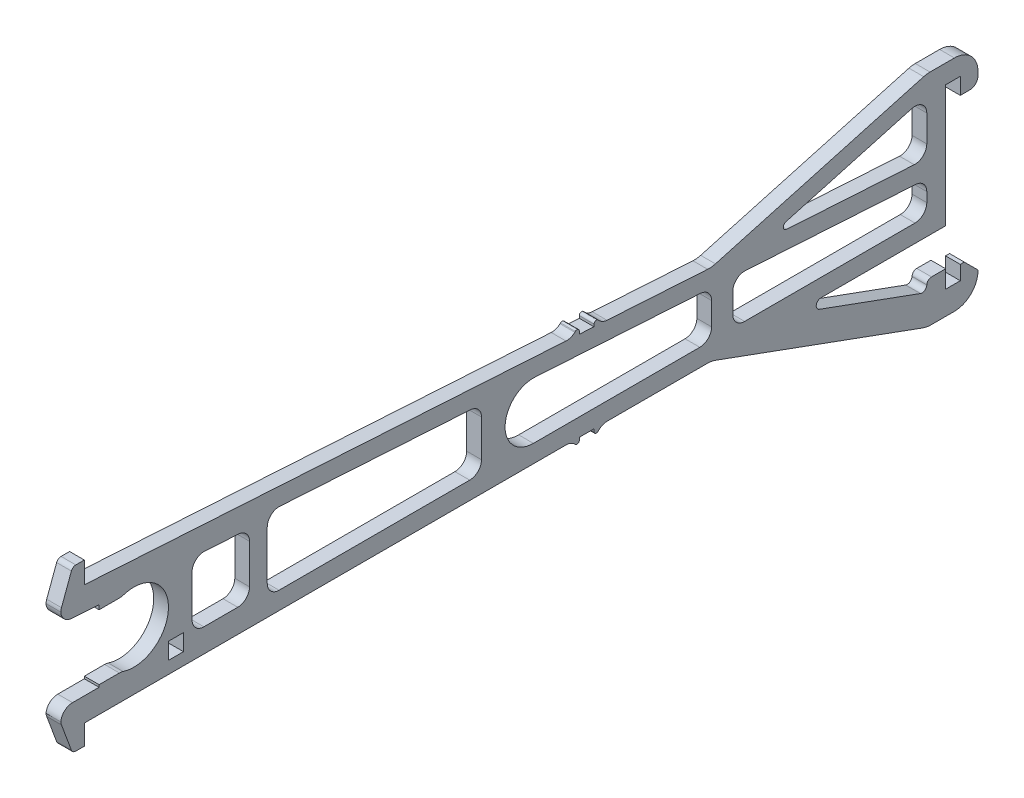
from build123d import *

# Parameters (mm, degrees)
BOSS_EXTRUDE1_DEPTH = 1.5875
CUT_EXTRUDE2_DEPTH  = 93.054574745
FILLET1_R           = 2.54
FILLET2_R           = 1.27
FILLET3_R           = 0.508
FILLET4_R           = 0.508
BOSS_EXTRUDE3_DEPTH = 1.5875
FILLET5_R           = 1.27
FILLET6_R           = 0.254
BOSS_EXTRUDE4_DEPTH = 1.5875
CUT_EXTRUDE1_REACH  = 94.055
FILLET9_R           = 1.27
FILLET10_R          = 0.381
FILLET12_R          = 1.27
FILLET13_R          = 0.508


with BuildPart() as part:
    # Sketch1 → Boss-Extrude1 (new body)
    with BuildSketch(Plane(origin=(0, 0, 0), x_dir=(0, 0, -1), z_dir=(1, 0, 0))):
        with BuildLine():
            Line((62.185099246, -6.2738), (85.344, -14.722370106))
            Line((85.344, -14.722370106), (88.3158, -14.722370106))
            ThreePointArc((88.3158, -14.722370106), (90.111851224, -13.978421331), (90.8558, -12.182370106))
            Line((90.8558, -12.182370106), (90.8558, -12.131570106))
            Line((90.8558, -12.131570106), (89.3826, -10.658370106))
            Line((89.3826, -10.658370106), (88.9508, -10.658370106))
            Line((88.9508, -10.658370106), (88.9508, -12.182370106))
            Line((88.9508, -12.182370106), (87.376, -12.182370106))
            Line((87.376, -12.182370106), (87.376, -10.277370106))
            Line((87.376, -10.277370106), (85.344, -10.277370106))
            Line((85.344, -10.277370106), (85.344, -11.477881212))
            Line((85.344, -11.477881212), (71.07876946, -6.2738))
            Line((71.07876946, -6.2738), (87.376, -6.2738))
            Line((87.376, -6.2738), (87.376, 6.867629894))
            Line((87.376, 6.867629894), (88.9508, 6.867629894))
            Line((88.9508, 6.867629894), (88.9508, 5.089629894))
            Line((88.9508, 5.089629894), (89.9668, 5.089629894))
            ThreePointArc((89.9668, 5.089629894), (90.595417928, 5.350011965), (90.8558, 5.978629894))
            Line((90.8558, 5.978629894), (90.8558, 6.359629894))
            ThreePointArc((90.8558, 6.359629894), (90.111851224, 8.155681118), (88.3158, 8.899629894))
            Line((88.3158, 8.899629894), (85.344, 8.899629894))
            Line((85.344, 8.899629894), (62.185099246, 2.453000952))
            Line((62.185099246, 2.453000952), (-5.3213, 6.613676867))
            Line((-5.3213, 6.613676867), (-5.3213, 8.924406911))
            Line((-5.3213, 8.924406911), (-7.8613, 8.924406911))
            Line((-7.8613, 8.924406911), (-7.8613, 4.225406911))
            Line((-7.8613, 4.225406911), (-3.7338, 3.971013401))
            Line((-3.7338, 3.971013401), (-3.7338, 3.488413401))
            Line((-3.7338, 3.488413401), (-1.331252938, 3.488413401))
            ThreePointArc((-1.331252938, 3.488413401), (3.7338, 0), (-1.331252938, -3.488413401))
            Line((-1.331252938, -3.488413401), (-3.7338, -3.488413401))
            Line((-3.7338, -3.488413401), (-3.7338, -3.7338))
            Line((-3.7338, -3.7338), (-5.3213, -3.7338))
            Line((-5.3213, -3.7338), (-7.8613, -3.7338))
            Line((-7.8613, -3.7338), (-7.8613, -8.4328))
            Line((-7.8613, -8.4328), (-5.3213, -8.4328))
            Line((-5.3213, -8.4328), (-5.3213, -6.2738))
            Line((-5.3213, -6.2738), (62.185099246, -6.2738))
        make_face()
        Polygon((12.4587, -3.7338), (6.2738, -3.7338), (6.2738, 3.354206983), (12.4587, 2.973008093), align=None, mode=Mode.SUBTRACT)
        Polygon((14.3637, -4.3688), (14.3637, 3.495415512), (37.420099246, 2.074362011), (37.420099246, -4.3688), align=None, mode=Mode.SUBTRACT)
        Polygon((64.471099246, -4.3688), (64.471099246, 0.407106085), (85.344, -0.879370106), (85.344, -4.3688), align=None, mode=Mode.SUBTRACT)
        Polygon((39.325099246, -4.3688), (39.325099246, 1.956949622), (62.185099246, 0.548000952), (62.185099246, -4.3688), align=None, mode=Mode.SUBTRACT)
        Polygon((85.344, 6.922200335), (85.344, 1.025629894), (68.00108793, 2.094539469), align=None, mode=Mode.SUBTRACT)
    extrude(amount=BOSS_EXTRUDE1_DEPTH)

    # Sketch7 → Cut-Extrude2 (cut, through all)
    with BuildSketch(Plane.ZY):
        Polygon((6.5913, 8.924406911), (7.8613, 5.495406911), (7.8613, 8.924406911), align=None)
        Polygon((6.5913, -8.4328), (7.8613, -5.0038), (7.8613, -8.4328), align=None)
    extrude(amount=-CUT_EXTRUDE2_DEPTH, mode=Mode.SUBTRACT)

    # Fillet1
    fillet1_edges = [part.edges().sort_by_distance(p)[0] for p in [
        (0.79375, 2.453000952, -62.185099246),
        (0.79375, 8.899629894, -85.344),
        (0.79375, -14.722370106, -85.344),
        (0.79375, -6.2738, -62.185099246),
    ]]
    fillet(fillet1_edges, radius=FILLET1_R)

    # Fillet2
    fillet2_edges = [part.edges().sort_by_distance(p)[0] for p in [
        (0.79375, -4.3688, -85.344),
        (0.79375, -0.879370106, -85.344),
        (0.79375, 0.407106085, -64.471099246),
        (0.79375, -4.3688, -64.471099246),
        (0.79375, 1.025629894, -85.344),
        (0.79375, 6.922200335, -85.344),
        (0.79375, -4.3688, -37.420099246),
        (0.79375, 2.074362011, -37.420099246),
        (0.79375, 3.495415512, -14.3637),
        (0.79375, -4.3688, -14.3637),
        (0.79375, -4.3688, -62.185099246),
        (0.79375, 0.548000952, -62.185099246),
        (0.79375, -3.7338, -12.4587),
        (0.79375, 2.973008093, -12.4587),
        (0.79375, 3.354206983, -6.2738),
        (0.79375, -3.7338, -6.2738),
    ]]
    fillet(fillet2_edges, radius=FILLET2_R)

    # Fillet3
    fillet3_edges = [part.edges().sort_by_distance(p)[0] for p in [
        (0.79375, -6.2738, -71.07876946),
        (0.79375, -11.477881212, -85.344),
    ]]
    fillet(fillet3_edges, radius=FILLET3_R)

    # Fillet4
    fillet4_edges = [part.edges().sort_by_distance(p)[0] for p in [
        (0.79375, -10.277370106, -85.344),
    ]]
    fillet(fillet4_edges, radius=FILLET4_R)

    # Sketch6 → Boss-Extrude3 (add)
    with BuildSketch(Plane.ZY.offset(-1.5875)):
        Polygon((-47.9467, -6.2738), (-47.0577, -6.2738), (-47.9467, -7.1628), align=None)
        Polygon((-49.5342, -6.2738), (-50.4232, -6.2738), (-49.5342, -7.1628), align=None)
        Polygon((-49.5342, 3.232723947), (-50.421516262, 3.178035274), (-49.5342, 4.121723947), align=None)
        Polygon((-47.059383738, 3.385256278), (-47.9467, 4.219567605), (-47.9467, 3.330567605), align=None)
        Polygon((-47.9467, 4.219567605), (-47.9467, 3.330567605), (-47.059383738, 3.385256278), align=None)
        Polygon((-49.5342, 4.121723947), (-49.5342, 3.232723947), (-50.421516262, 3.178035274), align=None)
        Polygon((-50.4232, -6.2738), (-49.5342, -7.1628), (-49.5342, -6.2738), align=None)
        Polygon((-47.9467, -7.1628), (-47.9467, -6.2738), (-47.0577, -6.2738), align=None)
    extrude(amount=BOSS_EXTRUDE3_DEPTH)

    # Fillet5
    fillet5_edges = [part.edges().sort_by_distance(p)[0] for p in [
        (0.79375, 3.385256278, -47.059383738),
        (0.79375, 3.178035274, -50.421516262),
        (0.79375, -6.2738, -50.4232),
        (0.79375, -6.2738, -47.0577),
    ]]
    fillet(fillet5_edges, radius=FILLET5_R)

    # Fillet6
    fillet6_edges = [part.edges().sort_by_distance(p)[0] for p in [
        (0.79375, 4.219567605, -47.9467),
        (0.79375, 4.121723947, -49.5342),
        (0.79375, -7.1628, -49.5342),
        (0.79375, -7.1628, -47.9467),
    ]]
    fillet(fillet6_edges, radius=FILLET6_R)

    # Sketch4 → Boss-Extrude4 (add)
    with BuildSketch(Plane(origin=(1.5875, 0, 0), x_dir=(0, 0, -1), z_dir=(1, 0, 0))):
        with BuildLine():
            Line((39.325099246, 1.956949622), (43.194043845, 1.718491864))
            ThreePointArc((43.194043845, 1.718491864), (39.961542096, -1.228517825), (43.006630195, -4.3688))
            Line((43.006630195, -4.3688), (39.325099246, -4.3688))
            Line((39.325099246, -4.3688), (39.325099246, 1.956949622))
        make_face()
    extrude(amount=-BOSS_EXTRUDE4_DEPTH)

    # Sketch5 → Cut-Extrude1 (cut, up to next)
    with BuildSketch(Plane(origin=(1.5875, 0, 0), x_dir=(0, 0, -1), z_dir=(1, 0, 0)), mode=Mode.PRIVATE) as cut_extrude1_sk1:
        Polygon((3.7592, -4.445), (3.7592, -4.953), (5.3467, -4.953), (5.3467, -4.445), (5.3467, -3.683), (5.3467, -3.175), (3.7592, -3.175), (3.7592, -3.683), align=None)
    cut_extrude1_tool1 = extrude(cut_extrude1_sk1.sketch, amount=-CUT_EXTRUDE1_REACH, mode=Mode.PRIVATE) & part.part
    add(cut_extrude1_tool1.solids().sort_by_distance((1.5875, -4.064, -4.55295))[0], mode=Mode.SUBTRACT)

    # Fillet9
    fillet9_edges = [part.edges().sort_by_distance(p)[0] for p in [
        (0.79375, 3.488413401, 1.331252938),
        (0.79375, -3.488413401, 1.331252938),
    ]]
    fillet(fillet9_edges, radius=FILLET9_R)

    # Fillet10
    fillet10_edges = [part.edges().sort_by_distance(p)[0] for p in [
        (0.79375, 2.094539469, -68.00108793),
    ]]
    fillet(fillet10_edges, radius=FILLET10_R)

    # Fillet12
    # the kernel refuses this fillet: 1.27 mm, written as the material it takes off along each edge
    with BuildSketch(Plane(origin=(-0.569074331, -5.0038, 7.8613), x_dir=(0, 1, 0), z_dir=(1, 0, 0))) as fillet12_piece_1:
        with BuildLine():
            CenterArc((FILLET12_R * 0.179236009778, -FILLET12_R), FILLET12_R, 90, 20.32313683)
            Line((-FILLET12_R * 0.168078346046, -FILLET12_R * 0.0622512392763), (0, 0))
            Line((0, 0), (FILLET12_R * 0.179236009778, 0))
        make_face()
    extrude(amount=2.725648662, mode=Mode.SUBTRACT)
    with BuildSketch(Plane(origin=(-3.175, -3.7338, 7.8613), x_dir=(0, 1.571796061637141e-12, -1.0), z_dir=(1, 0, 0))) as fillet12_piece_2:
        with BuildLine():
            CenterArc((FILLET12_R, -FILLET12_R), FILLET12_R, 90, 90)
            Line((0, -FILLET12_R), (0, 0))
            Line((0, 0), (FILLET12_R, 0))
        make_face()
    extrude(amount=7.9375, mode=Mode.SUBTRACT)
    with BuildSketch(Plane(origin=(-0.569074331, 5.495406911, 7.8613), x_dir=(0, -1, 0), z_dir=(1, 0, 0))) as fillet12_piece_3:
        with BuildLine():
            CenterArc((FILLET12_R * 0.179236009778, FILLET12_R), FILLET12_R, 249.67686317, 20.32313683)
            Line((-FILLET12_R * 0.168078346046, FILLET12_R * 0.0622512392763), (0, 0))
            Line((0, 0), (FILLET12_R * 0.179236009778, 0))
        make_face()
    extrude(amount=2.725648662, mode=Mode.SUBTRACT)
    with BuildSketch(Plane(origin=(-2.985337445, 4.225406911, 7.8613), x_dir=(0, -0.06151706759749907, -0.9981060316390262), z_dir=(1, 0, 0))) as fillet12_piece_4:
        with BuildLine():
            CenterArc((FILLET12_R * 0.940263762219, FILLET12_R), FILLET12_R, 183.526895232, 86.473104768)
            Line((-FILLET12_R * 0.0578422694199, FILLET12_R * 0.938482932403), (0, 0))
            Line((0, 0), (FILLET12_R * 0.940263762219, 0))
        make_face()
    extrude(amount=7.55817489, mode=Mode.SUBTRACT)

    # Fillet13
    fillet13_edges = [part.edges().sort_by_distance(p)[0] for p in [
        (0.79375, 8.924406911, 6.5913),
        (0.79375, -8.4328, 6.5913),
    ]]
    fillet(fillet13_edges, radius=FILLET13_R)


solid = part.part
